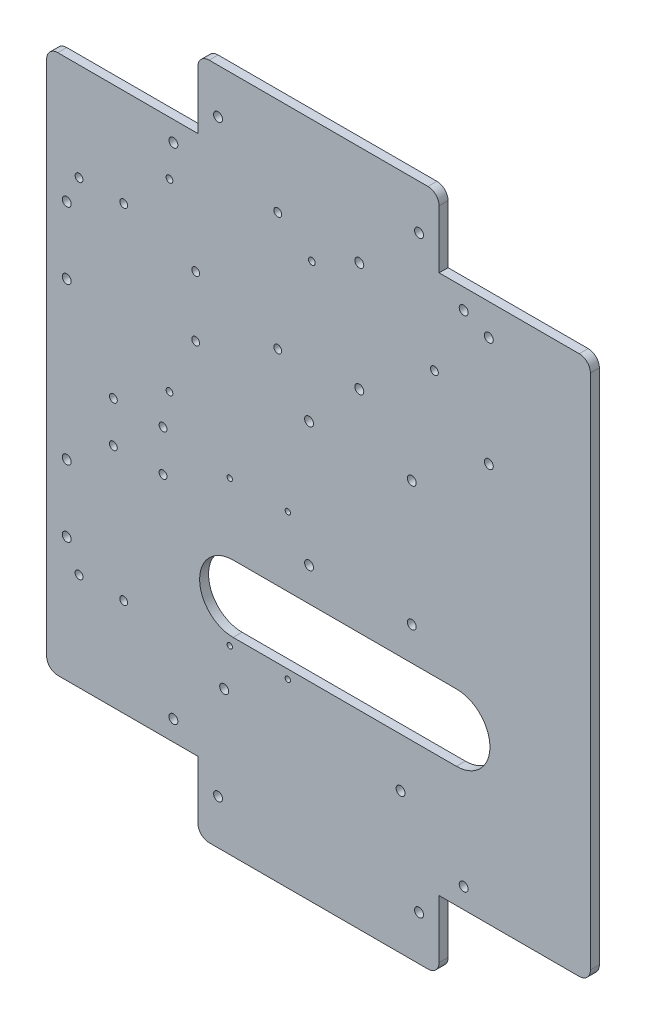
from build123d import *

# Parameters (mm, degrees)
BASE_DEPTH                       = 4
CONG_1_R                         = 3
ENL_V_MAT_EXTRU_1_DEPTH          = 383.51363606
ESQUISSE33_R                     = 1.75
PERCAGE_MAIN_DE_DIEU_DEPTH       = 379.324205543
ESQUISSE26_R                     = 2
PERCAGE_BUCK_CONVERTER_DEPTH     = 379.324205543
ESQUISSE27_R                     = 2
PERCAGE_TEENSY_MOTEUR_DEPTH      = 379.324205543
ESQUISSE28_R                     = 1.5
PERCAGE_CARTE_ALIM_DEPTH         = 379.324205543
ESQUISSE29_R                     = 2
PERCAGE_RASP_DEPTH               = 379.324205543
ESQUISSE32_R                     = 1.75
PERCAGE_TEENSY_ACTIONNEURS_DEPTH = 379.324205543
ESQUISSE30_R                     = 2
PERCAGE_ALIM_ACTIONNEURS_DEPTH   = 379.324205543
PER_AGE_FILS_DEPTH               = 379.324205543
ESQUISSE34_R                     = 1.75
PER_AGE_MOTEUR_ASCENSEUR_DEPTH   = 379.324205543
ESQUISSE35_R                     = 1.2
PER_AGE_DRIVER_ASCENSEUR_DEPTH   = 379.324205543
ESQUISSE36_R                     = 1.75
ENL_V_MAT_EXTRU_2_DEPTH          = 5
ESQUISSE39_R                     = 2
PER_AGE_EQUERRE_DEPTH            = 379.324205543
ESQUISSE38_W                     = 67.748737342
ESQUISSE38_H                     = 31
ENL_V_MAT_EXTRU_3_DEPTH          = 379.324205543
CONG_2_R                         = 5


with BuildPart() as part:
    # Esquisse1 → Base (new body)
    with BuildSketch(Plane.XY):
        Polygon((0, 0), (-200, 0), (-224.748737342, 24.748737342), (-224.748737342, 284.748737342), (-200, 309.497474683), (0, 309.497474683), (24.748737342, 284.748737342), (24.748737342, 24.748737342), align=None)
    extrude(amount=BASE_DEPTH)

    # Congé1
    cong_1_edges = [part.edges().sort_by_distance(p)[0] for p in [
        (-200, 0, 2),
        (-224.748737342, 24.748737342, 2),
        (-224.748737342, 284.748737342, 2),
        (-200, 309.497474683, 2),
        (0, 309.497474683, 2),
        (24.748737342, 284.748737342, 2),
        (24.748737342, 24.748737342, 2),
        (0, 0, 2),
    ]]
    fillet(cong_1_edges, radius=CONG_1_R)

    # Esquisse25 → Enlèv. mat.-Extru.1 (cut, through all)
    with BuildSketch(Plane(origin=(0, 0, 0), x_dir=(-1, 0, 0), z_dir=(0, 0, -1))):
        Polygon((-24.748737342, 33), (-24.748737342, 0), (45, 0), (155, 0), (224.748737342, 0), (224.748737342, 33), (224.748737342, 276.497474683), (224.748737342, 309.497474683), (155, 309.497474683), (45, 309.497474683), (-24.748737342, 309.497474683), (-24.748737342, 276.497474683), align=None)
        Polygon((-21.748737342, 33), (45, 33), (45, 3), (155, 3), (155, 33), (221.748737342, 33), (221.748737342, 276.497474683), (155, 276.497474683), (155, 306.497474683), (45, 306.497474683), (45, 276.497474683), (-21.748737342, 276.497474683), align=None, mode=Mode.SUBTRACT)
    extrude(amount=-ENL_V_MAT_EXTRU_1_DEPTH, mode=Mode.SUBTRACT)

    # Esquisse33 → Percage Main_De_Dieu (cut, through all)
    with BuildSketch(Plane.XY.offset(4)):
        with Locations((-207.248737342, 231.748737342)):
            Circle(ESQUISSE33_R)
        with Locations((-187.248737342, 231.748737342)):
            Circle(ESQUISSE33_R)
        with Locations((-207.248737342, 77.748737342)):
            Circle(ESQUISSE33_R)
        with Locations((-187.248737342, 77.748737342)):
            Circle(ESQUISSE33_R)
    extrude(amount=-PERCAGE_MAIN_DE_DIEU_DEPTH, mode=Mode.SUBTRACT)

    # Esquisse26 → Percage Buck Converter (cut, through all)
    with BuildSketch(Plane(origin=(0, 0, 0), x_dir=(-1, 0, 0), z_dir=(0, 0, -1))):
        with Locations((212.748737342, 189.748737342)):
            Circle(ESQUISSE26_R)
        with Locations((212.748737342, 219.748737342)):
            Circle(ESQUISSE26_R)
        with Locations((212.748737342, 89.748737342)):
            Circle(ESQUISSE26_R)
        with Locations((212.748737342, 119.748737342)):
            Circle(ESQUISSE26_R)
    extrude(amount=-PERCAGE_BUCK_CONVERTER_DEPTH, mode=Mode.SUBTRACT)

    # Esquisse27 → Percage Teensy Moteur (cut, through all)
    with BuildSketch(Plane(origin=(0, 0, 0), x_dir=(-1, 0, 0), z_dir=(0, 0, -1))):
        with Locations((142.251262658, 66)):
            Circle(ESQUISSE27_R)
        with Locations((63.251262658, 66)):
            Circle(ESQUISSE27_R)
    extrude(amount=-PERCAGE_TEENSY_MOTEUR_DEPTH, mode=Mode.SUBTRACT)

    # Esquisse28 → Percage Carte Alim (cut, through all)
    with BuildSketch(Plane(origin=(0, 0, 0), x_dir=(-1, 0, 0), z_dir=(0, 0, -1))):
        with Locations((166.748737342, 251.497474683)):
            Circle(ESQUISSE28_R)
        with Locations((102.998737342, 251.497474683)):
            Circle(ESQUISSE28_R)
        with Locations((166.748737342, 169.022474683)):
            Circle(ESQUISSE28_R)
    extrude(amount=-PERCAGE_CARTE_ALIM_DEPTH, mode=Mode.SUBTRACT)

    # Esquisse29 → Percage Rasp (cut, through all)
    with BuildSketch(Plane(origin=(0, 0, 0), x_dir=(-1, 0, 0), z_dir=(0, 0, -1))):
        with Locations((81.748737342, 212.497474683)):
            Circle(ESQUISSE29_R)
        with Locations((23.748737342, 212.497474683)):
            Circle(ESQUISSE29_R)
        with Locations((23.748737342, 261.497474683)):
            Circle(ESQUISSE29_R)
        with Locations((81.748737342, 261.497474683)):
            Circle(ESQUISSE29_R)
    extrude(amount=-PERCAGE_RASP_DEPTH, mode=Mode.SUBTRACT)

    # Esquisse32 → Percage Teensy Actionneurs (cut, through all)
    with BuildSketch(Plane.XY.offset(4)):
        with Locations((-118.251262658, 262.827474683)):
            Circle(ESQUISSE32_R)
        with Locations((-118.251262658, 209.827474683)):
            Circle(ESQUISSE32_R)
        with Locations((-48.111262658, 236.497474683)):
            Circle(ESQUISSE32_R)
    extrude(amount=-PERCAGE_TEENSY_ACTIONNEURS_DEPTH, mode=Mode.SUBTRACT)

    # Esquisse30 → Percage Alim Actionneurs (cut, through all)
    with BuildSketch(Plane(origin=(0, 0, 0), x_dir=(-1, 0, 0), z_dir=(0, 0, -1))):
        with Locations((104.251262658, 133)):
            Circle(ESQUISSE30_R)
        with Locations((58.251262658, 133)):
            Circle(ESQUISSE30_R)
        with Locations((58.251262658, 188.8)):
            Circle(ESQUISSE30_R)
        with Locations((104.251262658, 188.8)):
            Circle(ESQUISSE30_R)
    extrude(amount=-PERCAGE_ALIM_ACTIONNEURS_DEPTH, mode=Mode.SUBTRACT)

    # Esquisse31 → Perçage Fils (cut, through all)
    with BuildSketch(Plane(origin=(0, 0, 0), x_dir=(-1, 0, 0), z_dir=(0, 0, -1))):
        with BuildLine():
            Line((138.251262658, 88), (38.251262658, 88))
            ThreePointArc((38.251262658, 88), (23.251262658, 103), (38.251262658, 118))
            Line((38.251262658, 118), (138.251262658, 118))
            ThreePointArc((138.251262658, 118), (153.251262658, 103), (138.251262658, 88))
        make_face()
    extrude(amount=-PER_AGE_FILS_DEPTH, mode=Mode.SUBTRACT)

    # Esquisse34 → Perçage Moteur Ascenseur (cut, through all)
    with BuildSketch(Plane(origin=(0, 0, 0), x_dir=(-1, 0, 0), z_dir=(0, 0, -1))):
        with Locations((169.623737342, 153.9)):
            Circle(ESQUISSE34_R)
        with Locations((191.873737342, 153.9)):
            Circle(ESQUISSE34_R)
        with Locations((169.623737342, 135.5)):
            Circle(ESQUISSE34_R)
        with Locations((191.873737342, 135.5)):
            Circle(ESQUISSE34_R)
    extrude(amount=-PER_AGE_MOTEUR_ASCENSEUR_DEPTH, mode=Mode.SUBTRACT)

    # Esquisse35 → Perçage Driver Ascenseur (cut, through all)
    with BuildSketch(Plane.XY.offset(4)):
        with Locations((-139.748737342, 149)):
            Circle(ESQUISSE35_R)
        with Locations((-113.748737342, 149)):
            Circle(ESQUISSE35_R)
        with Locations((-113.748737342, 84)):
            Circle(ESQUISSE35_R)
        with Locations((-139.748737342, 84)):
            Circle(ESQUISSE35_R)
    extrude(amount=-PER_AGE_DRIVER_ASCENSEUR_DEPTH, mode=Mode.SUBTRACT)

    # Esquisse36 → Enlèv. mat.-Extru.2 (cut)
    with BuildSketch(Plane.XY.offset(4)):
        with Locations((-155, 194.497474683)):
            Circle(ESQUISSE36_R)
        with Locations((-155, 221.497474683)):
            Circle(ESQUISSE36_R)
    extrude(amount=-ENL_V_MAT_EXTRU_2_DEPTH, mode=Mode.SUBTRACT)

    # Esquisse39 → Perçage Equerre (cut, through all)
    with BuildSketch(Plane.XY.offset(4)):
        with Locations((-145, 286.497474683)):
            Circle(ESQUISSE39_R)
        with Locations((-165, 266.497474683)):
            Circle(ESQUISSE39_R)
        with Locations((-35, 266.497474683)):
            Circle(ESQUISSE39_R)
        with Locations((-55, 286.497474683)):
            Circle(ESQUISSE39_R)
        with Locations((-35, 43)):
            Circle(ESQUISSE39_R)
        with Locations((-55, 23)):
            Circle(ESQUISSE39_R)
        with Locations((-165, 43)):
            Circle(ESQUISSE39_R)
        with Locations((-145, 23)):
            Circle(ESQUISSE39_R)
    extrude(amount=-PER_AGE_EQUERRE_DEPTH, mode=Mode.SUBTRACT)

    # Esquisse38 → Enlèv. mat.-Extru.3 (cut, through all)
    with BuildSketch(Plane(origin=(0, 0, 0), x_dir=(-1, 0, 0), z_dir=(0, 0, -1))):
        with Locations((12.125631329, 18.5)):
            Rectangle(ESQUISSE38_W, ESQUISSE38_H)
        with Locations((187.874368671, 18.5)):
            Rectangle(ESQUISSE38_W, ESQUISSE38_H)
        with Locations((187.874368671, 290.997474683)):
            Rectangle(ESQUISSE38_W, ESQUISSE38_H)
        with Locations((12.125631329, 290.997474683)):
            Rectangle(ESQUISSE38_W, ESQUISSE38_H)
    extrude(amount=-ENL_V_MAT_EXTRU_3_DEPTH, mode=Mode.SUBTRACT)

    # Congé2
    cong_2_edges = [part.edges().sort_by_distance(p)[0] for p in [
        (-221.748737342, 275.497474683, 2),
        (-154, 306.497474683, 2),
        (-46, 306.497474683, 2),
        (21.748737342, 275.497474683, 2),
        (-221.748737342, 34, 2),
        (-154, 3, 2),
        (-46, 3, 2),
        (21.748737342, 34, 2),
    ]]
    fillet(cong_2_edges, radius=CONG_2_R)


solid = part.part
